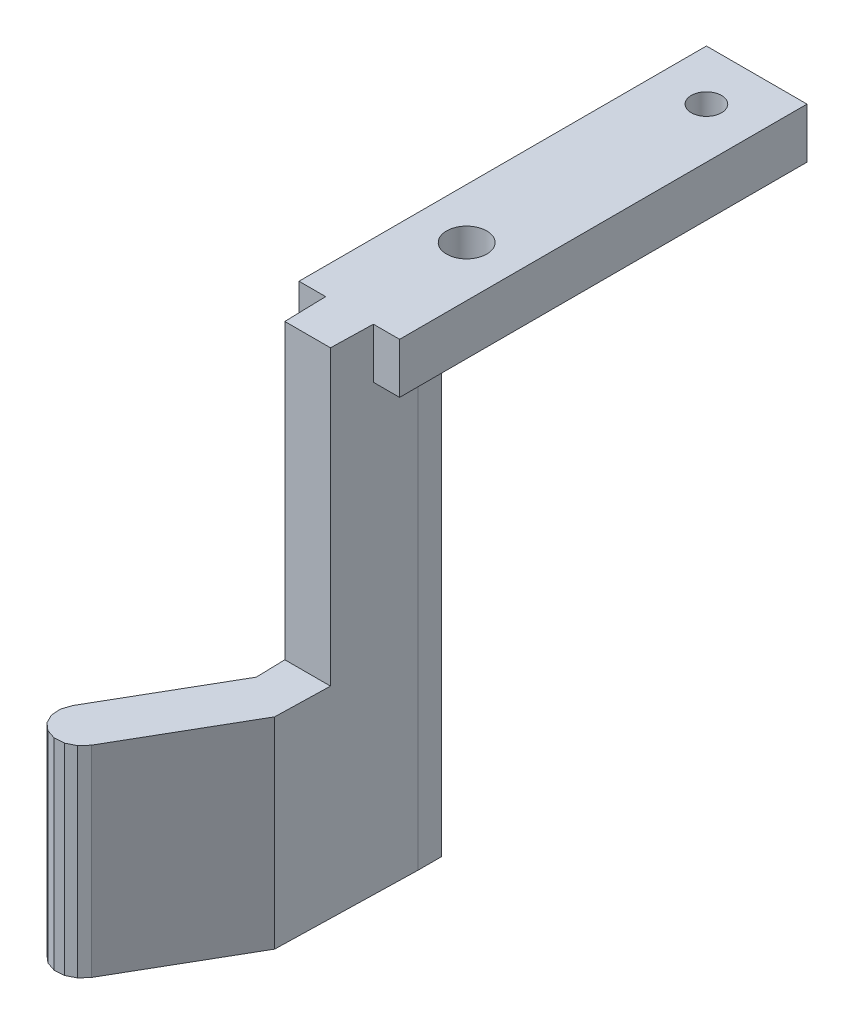
from build123d import *

# Parameters (mm, degrees)
BOSS_EXTRUDE1_START     = 7.2
SKETCH1_W               = 6
SKETCH1_H               = 3
BOSS_EXTRUDE1_DEPTH     = 24.3
BOSS_EXTRUDE2_START     = -6
BOSS_EXTRUDE2_DEPTH     = 29.475
CUT_EXTRUDE1_DEPTH      = 55.782352397
CUT_EXTRUDE1_DEPTH_BACK = 55.782352397
SKETCH3_R               = 1.2
SKETCH3_R_2             = 0.9
CUT_EXTRUDE2_DEPTH      = 55.782352397
CUT_EXTRUDE2_DEPTH_BACK = 55.782352397
SKETCH4_W               = 46
SKETCH4_H               = 18.475


with BuildPart() as part:
    # Sketch1 → Boss-Extrude1 (new body)
    with BuildSketch(Plane.XY.offset(BOSS_EXTRUDE1_START)):
        with Locations((17.8, 21.975)):
            Rectangle(SKETCH1_W, SKETCH1_H)
    extrude(amount=BOSS_EXTRUDE1_DEPTH)

    # Sketch2 → Boss-Extrude2 (add)
    with BuildSketch(Plane(origin=(0, 0, 0), x_dir=(1, 0, 0), z_dir=(0, 1, 0)).offset(BOSS_EXTRUDE2_START)):
        Polygon((16.3, -27.5), (16.3, -28.098076211), (16.500961894, -35.75), (12.500961894, -42.67820323), (12.312832708, -43.232413942), (12.351111261, -43.816431798), (12.60996999, -44.341345374), (13.05, -44.727241336), (13.604210712, -44.915370522), (14.188228568, -44.87709197), (14.713142144, -44.618233241), (15.099038106, -44.17820323), (19.099038106, -37.25), (19.3, -28.901923789), (19.3, -27.5), align=None)
    extrude(amount=BOSS_EXTRUDE2_DEPTH)

    # Sketch3 → Cut-Extrude1 (cut, two sides: drawn at the far end of the back side and taken through both)
    with BuildSketch(Plane(origin=(0, 0, 0), x_dir=(1, 0, 0), z_dir=(0, 1, 0)).offset(-CUT_EXTRUDE1_DEPTH_BACK)):
        with Locations((17.8, -24.5)):
            Circle(SKETCH3_R)
        with Locations((17.8, -10.2)):
            Circle(SKETCH3_R_2)
    extrude(amount=CUT_EXTRUDE1_DEPTH + CUT_EXTRUDE1_DEPTH_BACK, mode=Mode.SUBTRACT)

    # Sketch4 → Cut-Extrude2 (cut, two sides: drawn at the far end of the back side and taken through both)
    with BuildSketch(Plane(origin=(0, 0, 0), x_dir=(0, 0, -1), z_dir=(1, 0, 0)).offset(-CUT_EXTRUDE2_DEPTH_BACK)):
        with Locations((-57, 15.2375)):
            Rectangle(SKETCH4_W, SKETCH4_H)
    extrude(amount=CUT_EXTRUDE2_DEPTH + CUT_EXTRUDE2_DEPTH_BACK, mode=Mode.SUBTRACT)


solid = part.part
